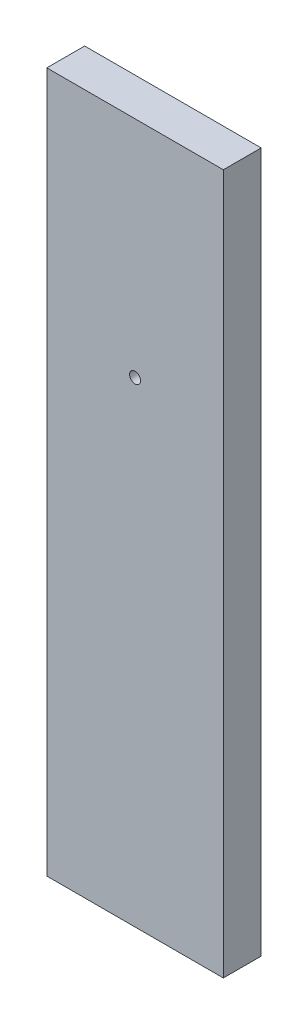
from build123d import *

# Parameters (mm, degrees)
SKETCH1_W           = 88.9
SKETCH1_H           = 19.05
BOSS_EXTRUDE1_DEPTH = 352.522028
SKETCH2_R           = 2.778125
CUT_EXTRUDE1_DEPTH  = 365.057540404


with BuildPart() as part:
    # Sketch1 → Boss-Extrude1 (new body)
    with BuildSketch(Plane(origin=(0, 0, 0), x_dir=(1, 0, 0), z_dir=(0, 1, 0))):
        with Locations((44.45, 9.525)):
            Rectangle(SKETCH1_W, SKETCH1_H)
    extrude(amount=BOSS_EXTRUDE1_DEPTH)

    # Sketch2 → Cut-Extrude1 (cut, through all)
    with BuildSketch(Plane.XY):
        with Locations((44.45, 239.641634)):
            Circle(SKETCH2_R)
    extrude(amount=-CUT_EXTRUDE1_DEPTH, mode=Mode.SUBTRACT)


solid = part.part
